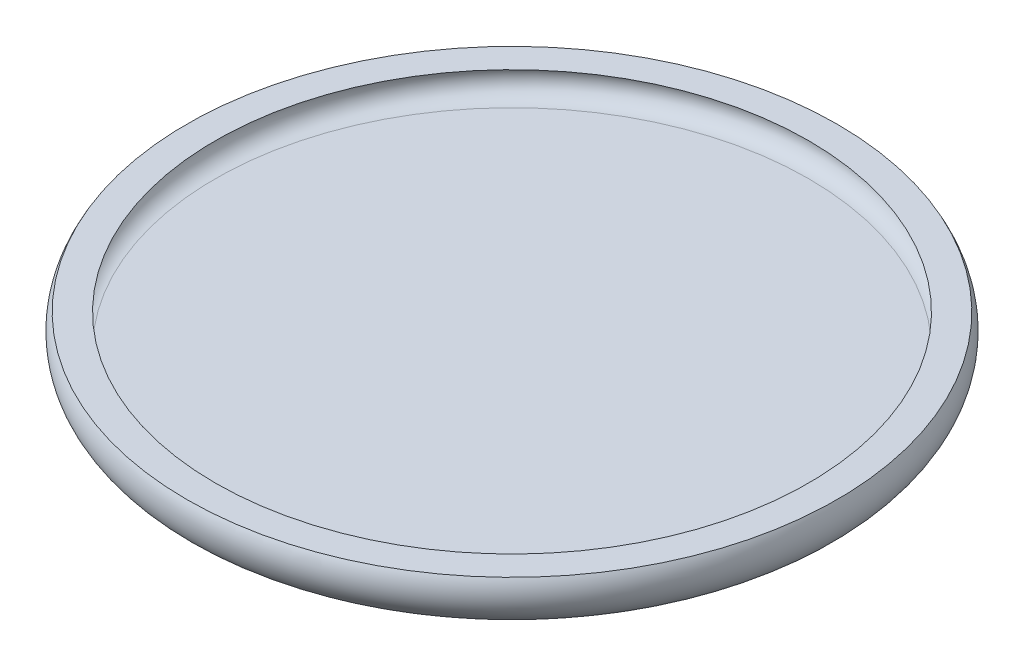
from build123d import *


with BuildPart() as part:
    # Sketch3 → Revolve1 (revolve)
    with BuildSketch(Plane.XY):
        with BuildLine():
            ThreePointArc((-19.732050808, 3), (-19.732050808, 1), (-18, 0))
            Line((-18, 0), (0, 0))
            Line((0, 0), (0, 1))
            Line((0, 1), (-18, 1))
            ThreePointArc((-18, 1), (-19, 2), (-18, 3))
            Line((-18, 3), (-19.732050808, 3))
        make_face()
    revolve(axis=Axis((0, 0, 0), (0, 1, 0)))


solid = part.part
